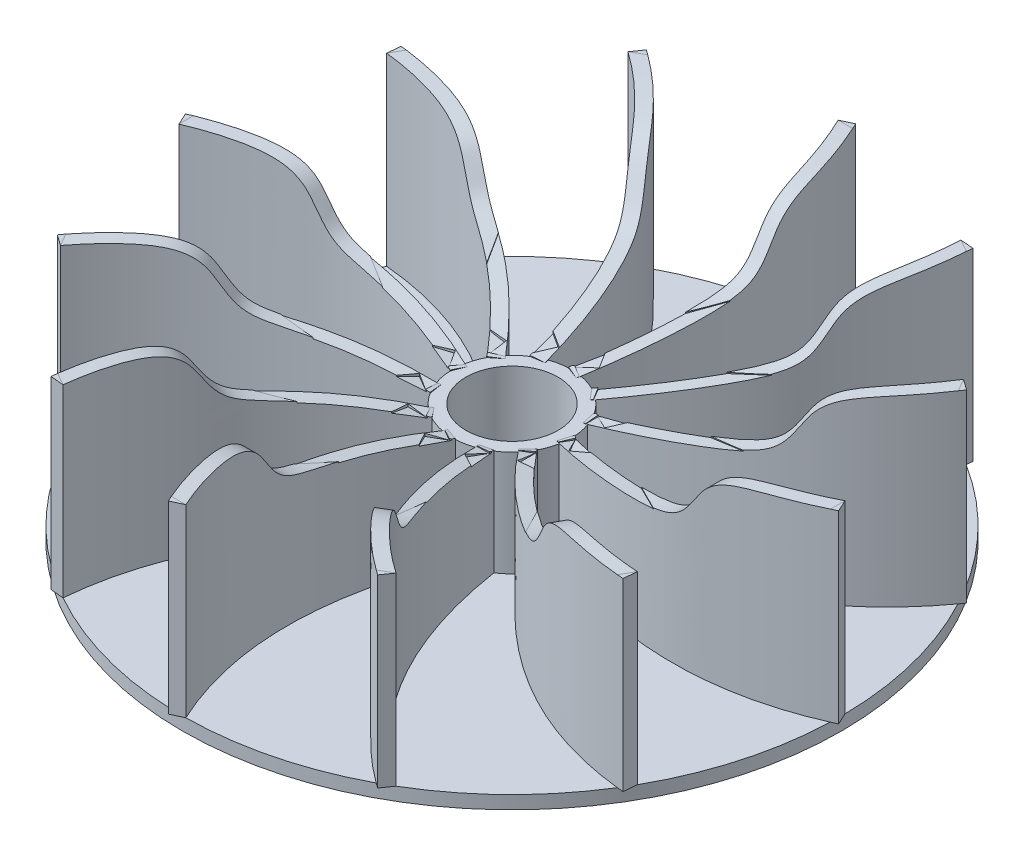
from build123d import *

# Parameters (mm, degrees)
SKETCH1_R           = 25
BOSS_EXTRUDE1_DEPTH = 1
SKETCH2_R           = 3.5
CUT_EXTRUDE1_DEPTH  = 1
BOSS_EXTRUDE2_START = 8
SKETCH4_R           = 4.5
SKETCH4_R_2         = 3.5
BOSS_EXTRUDE2_DEPTH = 8
EXTRUDE_THIN1_DEPTH = 14
CUT_EXTRUDE2_DEPTH  = 8
CIRPATTERN2_COUNT   = 12


# Read off the part's stored shape, not the designer's step: Extrude-Thin1
with BuildPart() as part:
    # Sketch1 → Boss-Extrude1 (new body)
    with BuildSketch(Plane(origin=(0, 0, 0), x_dir=(1, 0, 0), z_dir=(0, 1, 0))):
        with Locations(Location((0, 0, 0), (0, 0, 270))):
            Circle(SKETCH1_R)
    extrude(amount=BOSS_EXTRUDE1_DEPTH)

    # Sketch2 → Cut-Extrude1 (cut)
    with BuildSketch(Plane(origin=(0, 1, 0), x_dir=(1, 0, 0), z_dir=(0, 1, 0))):
        with Locations(Location((0, 0, 0), (0, 0, 270))):
            Circle(SKETCH2_R)
    extrude(amount=-CUT_EXTRUDE1_DEPTH, mode=Mode.SUBTRACT)

    # Sketch4 → Boss-Extrude2 (add)
    with BuildSketch(Plane(origin=(0, 1, 0), x_dir=(1, 0, 0), z_dir=(0, 1, 0)).offset(BOSS_EXTRUDE2_START)):
        with Locations(Location((0, 0, 0), (0, 0, 270))):
            Circle(SKETCH4_R)
        with Locations(Location((0, 0, 0), (0, 0, 270))):
            Circle(SKETCH4_R_2, mode=Mode.SUBTRACT)
    extrude(amount=-BOSS_EXTRUDE2_DEPTH)

    # Extrude-Thin1 outline → Extrude-Thin1 (add)
    with BuildSketch(Plane(origin=(0, 1, 0), x_dir=(1, 0, 0), z_dir=(0, 1, 0))):
        with BuildLine():
            Line((-0.201622438, 4.495480886), (0.730867969, 4.134286146))
            add(Edge.make_bspline(
                [(0.730867969, 4.134286146), (0.767889661, 4.229864428), (0.80445048, 4.325369227), (0.840550058, 4.420800335)],
                knots=[0, 0, 0, 0, 0.012562048, 0.012562048, 0.012562048, 0.012562048], degree=3))
            ThreePointArc((0.840550058, 4.420800335), (0.321638651, 4.488490679), (-0.201622438, 4.495480886))
        make_face()
        with BuildLine():
            ThreePointArc((-0.201622438, 4.495480886), (0.321638651, 4.488490679), (0.840550058, 4.420800335))
            add(Edge.make_bspline(
                [(0.840550058, 4.420800335), (2.241301241, 8.123758852), (2.947594173, 11.715766195), (2.927943951, 18.742912175), (2.161140875, 22.167601367), (0.647716925, 25.420492925)],
                knots=[0.012562048, 0.012562048, 0.012562048, 0.012562048, 0.5, 0.5, 1, 1, 1, 1], degree=3))
            Line((0.647716925, 25.420492925), (-0.258956098, 24.998658799))
            add(Edge.make_bspline(
                [(-0.201622438, 4.495480886), (4.106085198, 15.616617515), (-0.258956098, 24.998658799)],
                knots=[0, 0, 0, 1, 1, 1], degree=2))
        make_face()
    extrude_thin1 = extrude(amount=EXTRUDE_THIN1_DEPTH)

    # Sketch6 → Cut-Extrude2 (cut)
    with BuildSketch(Plane(origin=(3.746983586, 0, -0.014636971), x_dir=(0.003906304709072706, 0, 0.9999923703626543), z_dir=(-0.9999923703626544, 0, 0.003906304709072706))):
        with BuildLine():
            Line((-4.13139961, 9), (-4.13139961, 15))
            Line((-4.13139961, 15), (-24.99947963, 15))
            add(Edge.make_bspline(
                [(-24.99947963, 15), (-20.572733089, 14.848510962), (-18.10060752, 14.85060337), (-15.061618979, 9.692761016), (-13.760756359, 10.735922427), (-4.13139961, 9)],
                knots=[0, 0, 0, 0, 0.347769637, 0.451296061, 1, 1, 1, 1], degree=3))
        make_face()
    cut_extrude2 = extrude(amount=CUT_EXTRUDE2_DEPTH, mode=Mode.SUBTRACT)

    # CirPattern2: Extrude-Thin1, Cut-Extrude2 ×12 about axis
    cirpattern2_axis = Axis((0, 9, 0), (0, -1, 0))
    add([extrude_thin1.rotate(cirpattern2_axis, i * 360 / CIRPATTERN2_COUNT) for i in range(1, CIRPATTERN2_COUNT)])
    add([cut_extrude2.rotate(cirpattern2_axis, i * 360 / CIRPATTERN2_COUNT) for i in range(1, CIRPATTERN2_COUNT)], mode=Mode.SUBTRACT)


solid = part.part
